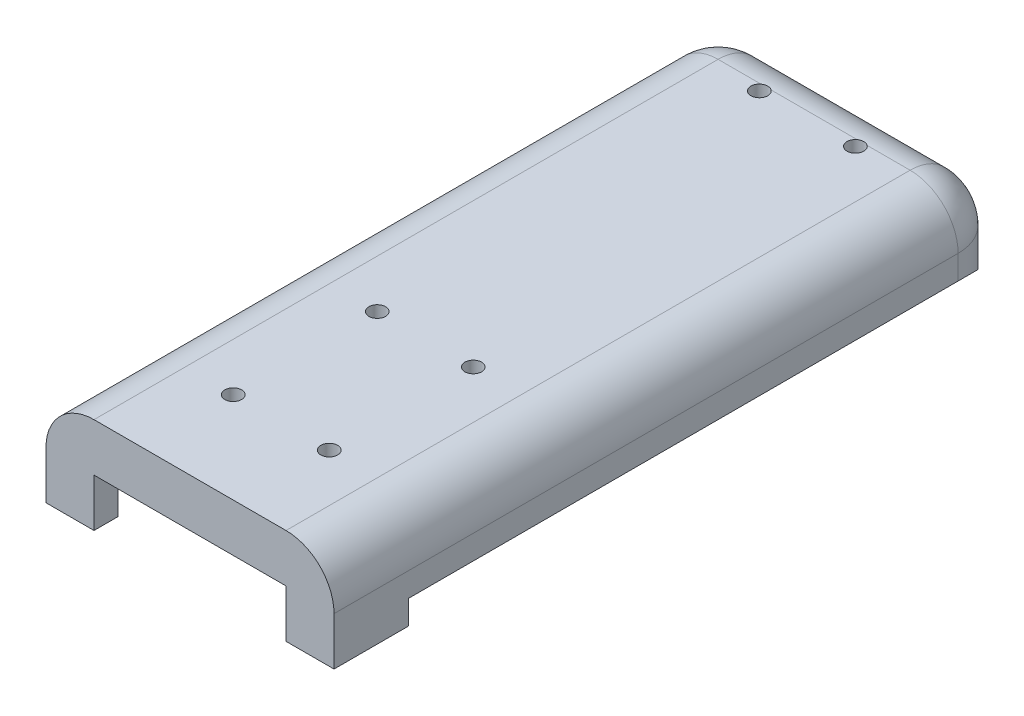
from build123d import *

# Parameters (mm, degrees)
BOSS_EXTRUDE1_DEPTH = 124.5
BOSS_EXTRUDE2_DEPTH = 15.5
SKETCH4_W           = 40
SKETCH4_H           = 10
CUT_EXTRUDE3_DEPTH  = 24.5
BOSS_EXTRUDE4_REACH = 155.623
SKETCH8_W           = 50
SKETCH8_H           = 5
SKETCH9_W           = 51
SKETCH9_H           = 5.5
CUT_EXTRUDE4_DEPTH  = 15.5
SKETCH10_R          = 6.75
SKETCH10_R_2        = 1.75
BOSS_EXTRUDE5_DEPTH = 19.4
SKETCH11_R          = 1.75
CUT_EXTRUDE5_DEPTH  = 154.622914957
FILLET1_R           = 10


with BuildPart() as part:
    # Sketch1 → Boss-Extrude1 (new body)
    with BuildSketch(Plane.XY):
        with BuildLine():
            Line((15, -5), (45, -5))
            ThreePointArc((45, -5), (52.071067812, -7.928932188), (55, -15))
            Line((55, -15), (55, -20))
            Line((55, -20), (60, -15))
            Line((60, -15), (60, -10))
            ThreePointArc((60, -10), (57.071067812, -2.928932188), (50, 0))
            Line((50, 0), (10, 0))
            ThreePointArc((10, 0), (2.928932188, -2.928932188), (0, -10))
            Line((0, -10), (0, -15))
            Line((0, -15), (5, -20))
            Line((5, -20), (5, -15))
            ThreePointArc((5, -15), (7.928932188, -7.928932188), (15, -5))
        make_face()
    extrude(amount=BOSS_EXTRUDE1_DEPTH)

    # Sketch2 → Boss-Extrude2 (add)
    with BuildSketch(Plane.XY.offset(124.5)):
        with BuildLine():
            Line((50, 0), (10, 0))
            ThreePointArc((10, 0), (2.928932188, -2.928932188), (0, -10))
            Line((0, -10), (0, -20))
            Line((0, -20), (5, -20))
            Line((5, -20), (55, -20))
            Line((55, -20), (60, -20))
            Line((60, -20), (60, -10))
            ThreePointArc((60, -10), (57.071067812, -2.928932188), (50, 0))
        make_face()
    extrude(amount=BOSS_EXTRUDE2_DEPTH)

    # Sketch4 → Cut-Extrude3 (cut)
    with BuildSketch(Plane.XY.offset(140)):
        with Locations((30, -15)):
            Rectangle(SKETCH4_W, SKETCH4_H)
    extrude(amount=-CUT_EXTRUDE3_DEPTH, mode=Mode.SUBTRACT)

    # Boss-Extrude4: up to this face of the body (flat: up to its plane)
    boss_extrude4_end = Plane(part.part.faces().sort_by_distance((30, -5, 62.25))[0])
    # Sketch8 → Boss-Extrude4 (add, up to the picked face)
    with BuildSketch(Plane.XZ.offset(20), mode=Mode.PRIVATE) as boss_extrude4_sk1:
        with Locations((30, 2.5)):
            Rectangle(SKETCH8_W, SKETCH8_H)
    boss_extrude4_tool1 = split(extrude(boss_extrude4_sk1.sketch, amount=-BOSS_EXTRUDE4_REACH, mode=Mode.PRIVATE), bisect_by=boss_extrude4_end, keep=Keep.BOTH, mode=Mode.PRIVATE)
    add(boss_extrude4_tool1.solids().sort_by(Axis((30, -20, 2.5), (0, 1, 0)))[0])

    # Sketch9 → Cut-Extrude4 (cut)
    with BuildSketch(Plane(origin=(0, -20, 0), x_dir=(-1, 0, 0), z_dir=(0, -1, 0))):
        with Locations((-30, -132.25)):
            Rectangle(SKETCH9_W, SKETCH9_H)
    extrude(amount=-CUT_EXTRUDE4_DEPTH, mode=Mode.SUBTRACT)

    # Sketch10 → Boss-Extrude5 (add)
    with BuildSketch(Plane(origin=(0, 0, 0), x_dir=(1, 0, 0), z_dir=(0, 1, 0))):
        with Locations((20, -11.4)):
            Circle(SKETCH10_R)
        with Locations(Location((20, -11.4, 0), (0, 0, 270))):
            Circle(SKETCH10_R_2, mode=Mode.SUBTRACT)
    boss_extrude5 = extrude(amount=-BOSS_EXTRUDE5_DEPTH)

    # Sketch11 → Cut-Extrude5 (cut, through all)
    with BuildSketch(Plane(origin=(0, 0, 0), x_dir=(1, 0, 0), z_dir=(0, 1, 0))):
        with Locations(Location((20, -11.4, 0), (0, 0, 270))):
            Circle(SKETCH11_R)
    cut_extrude5 = extrude(amount=-CUT_EXTRUDE5_DEPTH, mode=Mode.SUBTRACT)

    # Sketch-Pattern1: Boss-Extrude5, Cut-Extrude5 at 5 more places
    with Locations((20, 0, 0), (20, 0, 79.6), (0, 0, 79.6), (0, 0, 109.6), (20, 0, 109.6)):
        add(boss_extrude5)
        add(cut_extrude5, mode=Mode.SUBTRACT)

    # Fillet1
    # the kernel refuses this fillet: 10 mm, written as the material it takes off along each edge
    with BuildSketch(Plane(origin=(60, -40, 0), x_dir=(0, 0, 1), z_dir=(0, 1, 0)), Plane(origin=(0, -10, 0), x_dir=(0, 0, 1), z_dir=(0, -1, 0))) as fillet1_piece_1:
        with BuildLine():
            CenterArc((FILLET1_R, -FILLET1_R), FILLET1_R, 90, 90)
            Line((0, -FILLET1_R), (0, 0))
            Line((0, 0), (FILLET1_R, 0))
        make_face()
    extrude(amount=30, mode=Mode.SUBTRACT)
    with BuildSketch(Plane(origin=(50, -10, 0), x_dir=(1, 0, 0), z_dir=(0, -1, 0))) as fillet1_piece_2:
        with BuildLine():
            CenterArc((10 - FILLET1_R, FILLET1_R), FILLET1_R, 270, 90)
            Line((10, FILLET1_R), (10, 0))
            Line((10, 0), (10 - FILLET1_R, 0))
        make_face()
    revolve(axis=Axis((50, -10, 0), (0, 0, 1)), revolution_arc=90, mode=Mode.SUBTRACT)
    with BuildSketch(Plane(origin=(10, -10, 0), x_dir=(0, 1, 0), z_dir=(1, 0, 0))) as fillet1_piece_3:
        with BuildLine():
            CenterArc((10 - FILLET1_R, FILLET1_R), FILLET1_R, 270, 90)
            Line((10 - FILLET1_R, 0), (10, 0))
            Line((10, 0), (10, FILLET1_R))
        make_face()
    revolve(axis=Axis((10, -10, 0), (0, 0, 1)), revolution_arc=90, mode=Mode.SUBTRACT)
    with BuildSketch(Plane(origin=(50, 0, 0), x_dir=(0, 0, 1), z_dir=(-1, 0, 0))) as fillet1_piece_4:
        with BuildLine():
            CenterArc((FILLET1_R, -FILLET1_R), FILLET1_R, 90, 90)
            Line((0, -FILLET1_R), (0, 0))
            Line((0, 0), (FILLET1_R, 0))
        make_face()
    extrude(amount=40, mode=Mode.SUBTRACT)


solid = part.part
